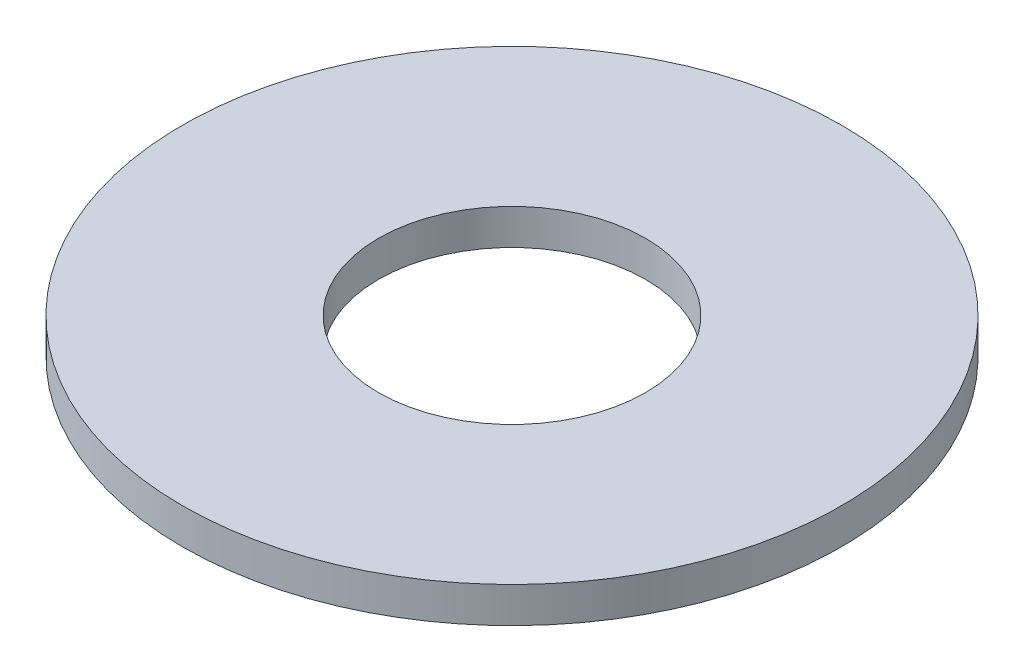
from build123d import *

# Parameters (mm, degrees)
SKETCH1_R           = 92.5
BOSS_EXTRUDE1_DEPTH = 10
SKETCH2_R           = 37.5
CUT_EXTRUDE1_DEPTH  = 132.196417634


with BuildPart() as part:
    # Sketch1 → Boss-Extrude1 (new body)
    with BuildSketch(Plane(origin=(0, 0, 0), x_dir=(1, 0, 0), z_dir=(0, 1, 0))):
        Circle(SKETCH1_R)
    extrude(amount=BOSS_EXTRUDE1_DEPTH)

    # Sketch2 → Cut-Extrude1 (cut, through all)
    with BuildSketch(Plane(origin=(0, 0, 0), x_dir=(1, 0, 0), z_dir=(0, 1, 0))):
        Circle(SKETCH2_R)
    extrude(amount=CUT_EXTRUDE1_DEPTH, mode=Mode.SUBTRACT)


solid = part.part
